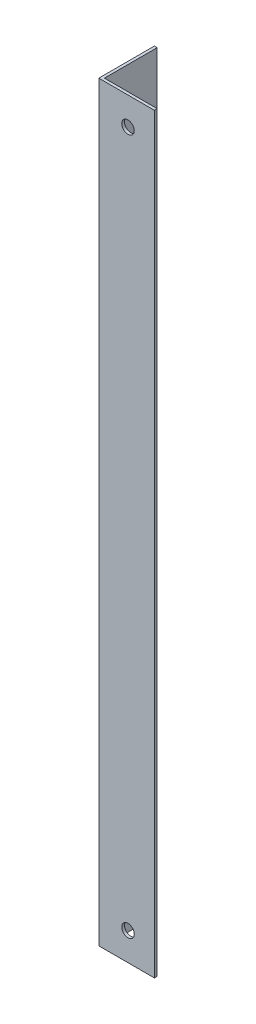
from build123d import *

# Parameters (mm, degrees)
EXTRUDE_1_DEPTH     = 270
SKETCH_2_R          = 2.25
CUT_EXTRUDE_1_DEPTH = 272.405600532
SKETCH_3_R          = 2.25
CUT_EXTRUDE_2_DEPTH = 272.405600532
SKETCH_4_R          = 2.25
CUT_EXTRUDE_3_DEPTH = 272.405600532
SKETCH_5_R          = 2.25
CUT_EXTRUDE_4_DEPTH = 272.405600532


with BuildPart() as part:
    # Эскиз1 → Бобышка-Вытянуть1 (new body)
    with BuildSketch(Plane(origin=(0, 0, 0), x_dir=(1, 0, 0), z_dir=(0, 1, 0))):
        Polygon((0, 0), (0, 20), (1, 20), (1, 1), (20, 1), (20, 0), align=None)
    extrude(amount=EXTRUDE_1_DEPTH)

    # Эскиз2 → Вырез-Вытянуть1 (cut, through all)
    with BuildSketch(Plane(origin=(1, 0, 0), x_dir=(0, 0, -1), z_dir=(1, 0, 0))):
        with Locations((10.5, 29.5)):
            Circle(SKETCH_2_R)
    extrude(amount=-CUT_EXTRUDE_1_DEPTH, mode=Mode.SUBTRACT)

    # Эскиз3 → Вырез-Вытянуть2 (cut, through all)
    with BuildSketch(Plane(origin=(0, 0, -1), x_dir=(-1, 0, 0), z_dir=(0, 0, -1))):
        with Locations((-10.5, 10)):
            Circle(SKETCH_3_R)
    extrude(amount=-CUT_EXTRUDE_2_DEPTH, mode=Mode.SUBTRACT)

    # Эскиз4 → Вырез-Вытянуть3 (cut, through all)
    with BuildSketch(Plane(origin=(0, 0, -1), x_dir=(-1, 0, 0), z_dir=(0, 0, -1))):
        with Locations((-10.5, 260)):
            Circle(SKETCH_4_R)
    extrude(amount=-CUT_EXTRUDE_3_DEPTH, mode=Mode.SUBTRACT)

    # Эскиз5 → Вырез-Вытянуть4 (cut, through all)
    with BuildSketch(Plane(origin=(1, 0, 0), x_dir=(0, 0, -1), z_dir=(1, 0, 0))):
        with Locations((10.5, 180.5)):
            Circle(SKETCH_5_R)
    extrude(amount=-CUT_EXTRUDE_4_DEPTH, mode=Mode.SUBTRACT)


solid = part.part
